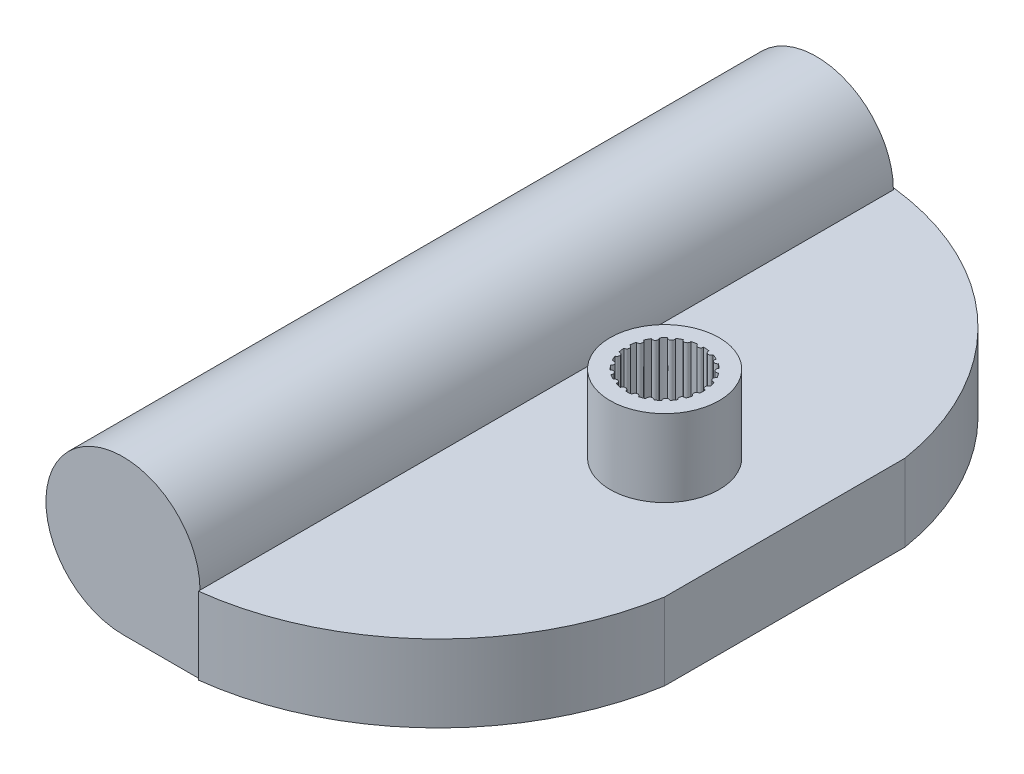
from build123d import *
from build123d.topology import SkipClean

# Parameters (mm, degrees)
BOSS_EXTRUDE7_DEPTH      = 2.5
BOSS_EXTRUDE7_DEPTH_BACK = 2.5
SKETCH1_R                = 1
SKETCH3_W                = 5
SKETCH3_H                = 5
SKETCH3_R                = 1
BOSS_EXTRUDE9_DEPTH      = 1
FILLET2_R                = 2.5
SKETCH4_R                = 3.54
SKETCH4_R_2              = 2.5
BOSS_EXTRUDE11_DEPTH     = 5
BOSS_EXTRUDE13_START     = -4
BOSS_EXTRUDE13_DEPTH     = 4
CIRPATTERN2_COUNT        = 21
SKETCH18_R               = 5
SKETCH18_R_2             = 4.05
BOSS_EXTRUDE24_DEPTH     = 45
SKETCH19_R               = 4.05
CUT_EXTRUDE2_DEPTH       = 55.105925545
BOSS_EXTRUDE25_START     = -5
SKETCH20_R               = 5
BOSS_EXTRUDE25_DEPTH     = 5
CUT_EXTRUDE4_DEPTH       = 45
BOSS_EXTRUDE35_DEPTH     = 5
SKETCH28_W               = 5
SKETCH28_H               = 1.900081374
CUT_EXTRUDE9_DEPTH       = 45
CUT_EXTRUDE10_DEPTH      = 45
CUT_EXTRUDE12_DEPTH      = 40
CUT_EXTRUDE12_DEPTH_BACK = 40
SKETCH32_R               = 4.05
CUT_EXTRUDE13_START      = -40
SKETCH33_R               = 1
CUT_EXTRUDE13_DEPTH      = 40


with BuildPart() as part:
    # Sketch1 → Boss-Extrude7 (new, two sides: drawn at the far end of the back side and taken through both)
    with BuildSketch(Plane(origin=(0, 0, 0), x_dir=(1, 0, 0), z_dir=(0, 1, 0)).offset(-BOSS_EXTRUDE7_DEPTH_BACK)):
        Polygon((-29.089537279, -2.019014343), (-29.089537279, -7.019014343), (-14.392838138, -12.322315202), (-9.089537279, -27.019014343), (-4.089537279, -27.019014343), (1.21376358, -12.322315202), (15.910462721, -7.019014343), (15.910462721, -2.019014343), (1.21376358, 3.284286516), (-4.089537279, 17.980985657), (-9.089537279, 17.980985657), (-14.392838138, 3.284286516), align=None)
        with Locations(Location((-6.589537279, -4.519014343, 0), (0, 0, 270))):
            Circle(SKETCH1_R, mode=Mode.SUBTRACT)
    extrude(amount=BOSS_EXTRUDE7_DEPTH + BOSS_EXTRUDE7_DEPTH_BACK)

    # Sketch3 → Boss-Extrude9 (add)
    with BuildSketch(Plane(origin=(0, 2.5, 0), x_dir=(1, 0, 0), z_dir=(0, 1, 0))):
        with Locations((-6.589537279, -4.519014343)):
            Rectangle(SKETCH3_W, SKETCH3_H)
        with Locations(Location((-6.589537279, -4.519014343, 0), (0, 0, 270))):
            Circle(SKETCH3_R, mode=Mode.SUBTRACT)
    extrude(amount=BOSS_EXTRUDE9_DEPTH)

    # Fillet2
    fillet2_edges = [part.edges().sort_by_distance(p)[0] for p in [
        (-4.089537279, 3, 7.019014343),
        (-4.089537279, 3, 2.019014343),
        (-9.089537279, 3, 7.019014343),
        (-9.089537279, 3, 2.019014343),
    ]]
    fillet(fillet2_edges, radius=FILLET2_R - 0.0001)  # a hair under: the kernel refuses the full size

    # Sketch4 → Boss-Extrude11 (add)
    with BuildSketch(Plane(origin=(0, 2.5, 0), x_dir=(1, 0, 0), z_dir=(0, 1, 0))):
        with Locations(Location((-6.589537279, -4.519014343, 0), (0, 0, 90))):
            Circle(SKETCH4_R)
        with Locations(Location((-6.589537279, -4.519014343, 0), (0, 0, 90))):
            Circle(SKETCH4_R_2, mode=Mode.SUBTRACT)
    extrude(amount=BOSS_EXTRUDE11_DEPTH)

    # Sketch8 → Boss-Extrude13 (add)
    with BuildSketch(Plane(origin=(0, 7.5, 0), x_dir=(1, 0, 0), z_dir=(0, 1, 0)).offset(BOSS_EXTRUDE13_START)):
        with BuildLine():
            ThreePointArc((-7.641010895, -2.250886649), (-7.405163574, -2.347475501), (-7.291219912, -2.119505751))
            ThreePointArc((-7.291219912, -2.119505751), (-7.468573367, -2.178652072), (-7.641010895, -2.250886649))
        make_face()
    boss_extrude13 = extrude(amount=BOSS_EXTRUDE13_DEPTH)

    # CirPattern2: Boss-Extrude13 ×21 about axis
    cirpattern2_axis = Axis((-6.589537279, 0, 4.519014343), (0, 1, 0))
    for i in range(1, CIRPATTERN2_COUNT):
        add(boss_extrude13.rotate(cirpattern2_axis, i * 360 / CIRPATTERN2_COUNT))

    # Sketch18 → Boss-Extrude24 (add)
    with BuildSketch(Plane(origin=(0, 0, -17.980985657), x_dir=(-1, 0, 0), z_dir=(0, 0, -1))):
        with Locations((19.242838138, 2.5)):
            Circle(SKETCH18_R)
        with Locations((19.242838138, 2.5)):
            Circle(SKETCH18_R_2, mode=Mode.SUBTRACT)
    extrude(amount=-BOSS_EXTRUDE24_DEPTH)

    # Sketch19 → Cut-Extrude2 (cut, through all)
    with BuildSketch(Plane(origin=(0, 0, -17.980985657), x_dir=(-1, 0, 0), z_dir=(0, 0, -1))):
        with Locations((19.242838138, 2.5)):
            Circle(SKETCH19_R)
    extrude(amount=-CUT_EXTRUDE2_DEPTH, mode=Mode.SUBTRACT)

    # Sketch20 → Boss-Extrude25 (add)
    with BuildSketch(Plane.XY.offset(27.019014343).offset(BOSS_EXTRUDE25_START)):
        with Locations(Location((-19.242838138, 2.5, 0), (0, 0, 180))):
            Circle(SKETCH20_R)
    extrude(amount=BOSS_EXTRUDE25_DEPTH)

    # Sketch24 → Cut-Extrude4 (cut)
    with SkipClean():  # the faces are left unmerged after this step: merging them gives an invalid solid
        with BuildSketch(Plane(origin=(0, 0, -17.980985657), x_dir=(-1, 0, 0), z_dir=(0, 0, -1))):
            with BuildLine():
                Line((19.242838138, -2.5), (29.239649505, -2.5))
                Line((29.239649505, -2.5), (29.239649505, 2.5))
                Line((29.239649505, 2.5), (24.242838138, 2.5))
                ThreePointArc((24.242838138, 2.5), (22.778372044, -1.035533906), (19.242838138, -2.5))
            make_face()
        extrude(amount=-CUT_EXTRUDE4_DEPTH, mode=Mode.SUBTRACT)

    # Sketch26 → Boss-Extrude35 (add)
    with BuildSketch(Plane(origin=(0, 2.5, 0), x_dir=(1, 0, 0), z_dir=(0, 1, 0))):
        with BuildLine():
            Line((1.21376358, 3.284286516), (1.21376358, -12.322315202))
            ThreePointArc((1.21376358, -12.322315202), (-5.970751226, -23.907365708), (-19.242838138, -27.019014343))
            Line((-19.242838138, -27.019014343), (-19.242838138, 17.980985657))
            ThreePointArc((-19.242838138, 17.980985657), (-5.970751226, 14.869337023), (1.21376358, 3.284286516))
        make_face()
    extrude(amount=-BOSS_EXTRUDE35_DEPTH)

    # Sketch28 → Cut-Extrude9 (cut)
    with BuildSketch(Plane(origin=(0, 2.5, 0), x_dir=(1, 0, 0), z_dir=(0, 1, 0))):
        Polygon((-19.242838138, 17.980985657), (-14.291903713, 18.094552541), (-14.291903713, 20.179520428), (-19.242838138, 20.179520428), align=None)
        with Locations((-16.742838138, -27.96905503)):
            Rectangle(SKETCH28_W, SKETCH28_H)
    extrude(amount=-CUT_EXTRUDE9_DEPTH, mode=Mode.SUBTRACT)

    # Sketch30 → Cut-Extrude10 (cut)
    with BuildSketch(Plane(origin=(0, 2.5, 0), x_dir=(1, 0, 0), z_dir=(0, 1, 0))):
        with BuildLine():
            Line((1.21376358, 3.284286516), (1.21376358, -12.322315202))
            ThreePointArc((1.21376358, -12.322315202), (-5.970751226, -23.907365708), (-19.242838138, -27.019014343))
            Line((-19.242838138, -27.019014343), (-19.242838138, -29.875538086))
            Line((-19.242838138, -29.875538086), (19.285813169, -29.875538086))
            Line((19.285813169, -29.875538086), (19.285813169, 19.780165104))
            Line((19.285813169, 19.780165104), (-19.242838138, 19.780165104))
            Line((-19.242838138, 19.780165104), (-19.242838138, 17.980985657))
            ThreePointArc((-19.242838138, 17.980985657), (-5.970751226, 14.869337023), (1.21376358, 3.284286516))
        make_face()
    extrude(amount=-CUT_EXTRUDE10_DEPTH, mode=Mode.SUBTRACT)

    # Sketch32 → Cut-Extrude12 (cut, two sides: drawn at the far end of the back side and taken through both)
    with BuildSketch(Plane(origin=(0, 0, -17.980985657), x_dir=(-1, 0, 0), z_dir=(0, 0, -1)).offset(-CUT_EXTRUDE12_DEPTH_BACK)):
        with Locations(Location((19.242838138, 2.5, 0), (0, 0, 180))):
            Circle(SKETCH32_R)
    extrude(amount=CUT_EXTRUDE12_DEPTH + CUT_EXTRUDE12_DEPTH_BACK, mode=Mode.SUBTRACT)

    # Sketch33 → Cut-Extrude13 (cut)
    with BuildSketch(Plane(origin=(0, 2.5, 0), x_dir=(1, 0, 0), z_dir=(0, 1, 0)).offset(CUT_EXTRUDE13_START)):
        with Locations(Location((-6.589537279, -4.519014343, 0), (0, 0, 270))):
            Circle(SKETCH33_R)
    extrude(amount=CUT_EXTRUDE13_DEPTH, mode=Mode.SUBTRACT)


solid = part.part
